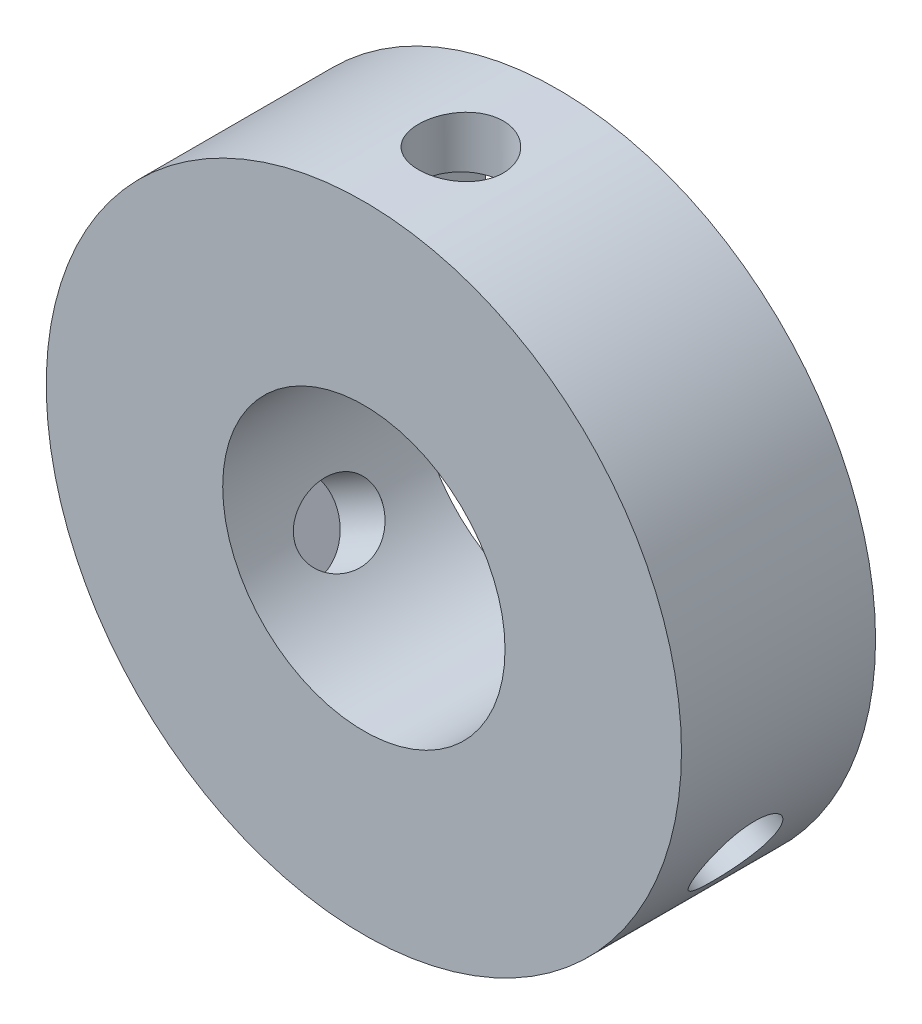
from build123d import *

# Parameters (mm, degrees)
SKETCH1_R           = 9
SKETCH1_R_2         = 4
BOSS_EXTRUDE1_DEPTH = 5.5
CUT_EXTRUDE1_DEPTH  = 1
CIRPATTERN1_COUNT   = 3


# Read off the part's stored shape, not the designer's step: M2 Clearance Hole1
with BuildPart() as part:
    # Sketch1 → Boss-Extrude1 (new body)
    with BuildSketch(Plane.XY):
        Circle(SKETCH1_R)
        Circle(SKETCH1_R_2, mode=Mode.SUBTRACT)
    extrude(amount=BOSS_EXTRUDE1_DEPTH)

    # Sketch2 → Cut-Extrude1 (cut, symmetric)
    with BuildSketch(Plane(origin=(0, 6.5, 0), x_dir=(1, 0, 0), z_dir=(0, 1, 0))):
        Polygon((0, -5.117136104), (2.05, -3.933568052), (2.05, -1.566431948), (0, -0.382863896), (-2.05, -1.566431948), (-2.05, -3.933568052), align=None)
        Polygon((2.05, 0), (2.05, -1.566431948), (0, -0.382863896), (-2.05, -1.566431948), (-2.05, 0), align=None)
    cut_extrude1 = extrude(amount=CUT_EXTRUDE1_DEPTH, both=True, mode=Mode.SUBTRACT)

    # M2 Clearance Hole1 outline → M2 Clearance Hole1 (revolve, cut)
    with BuildSketch(Plane.XY.offset(2.75)):
        Polygon((0, 3.874987804), (0.99194492, 3.874987804), (1.200000263, 4.000000158), (1.2, 5.5), (0, 5.5), align=None)
        Polygon((0, 7.5), (1.200000538, 7.5), (1.2, 9.000043312), (0, 9.000043312), align=None)
    m2_clearance_hole1 = revolve(axis=Axis((0, 0, 2.75), (0, 1, 0)), mode=Mode.SUBTRACT)

    # CirPattern1: Cut-Extrude1, M2 Clearance Hole1 ×3 about axis
    cirpattern1_axis = Axis((0, 0, 0), (0, 0, 1))
    add([cut_extrude1.rotate(cirpattern1_axis, i * 360 / CIRPATTERN1_COUNT) for i in range(1, CIRPATTERN1_COUNT)], mode=Mode.SUBTRACT)
    add([m2_clearance_hole1.rotate(cirpattern1_axis, i * 360 / CIRPATTERN1_COUNT) for i in range(1, CIRPATTERN1_COUNT)], mode=Mode.SUBTRACT)


solid = part.part
